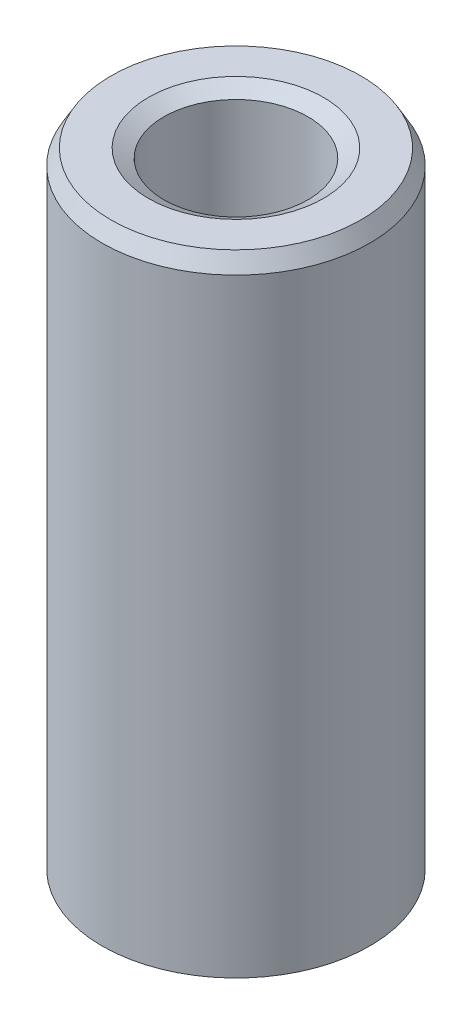
from build123d import *
from OCP.BRepFilletAPI import BRepFilletAPI_MakeChamfer

# Parameters (mm, degrees)
SKETCH1_R           = 30
BOSS_EXTRUDE1_DEPTH = 141.916776166
SKETCH2_R           = 16.142654892
CUT_EXTRUDE1_DEPTH  = 149.122825241
CHAMFER1_SIZE       = 3.484064007
CHAMFER1_SIZE2      = 2.011525292


with BuildPart() as part:
    # Sketch1 → Boss-Extrude1 (new body)
    with BuildSketch(Plane(origin=(0, 0, 0), x_dir=(1, 0, 0), z_dir=(0, 1, 0))):
        Circle(SKETCH1_R)
    extrude(amount=BOSS_EXTRUDE1_DEPTH)

    # Sketch2 → Cut-Extrude1 (cut, through all)
    with BuildSketch(Plane(origin=(0, 0, 0), x_dir=(1, 0, 0), z_dir=(0, 1, 0))):
        Circle(SKETCH2_R)
    extrude(amount=CUT_EXTRUDE1_DEPTH, mode=Mode.SUBTRACT)

    # Chamfer1: one chamfer whose edges measure the first distance from different faces: ONE call of the kernel's chamfer builder (chamfer() names one face for all edges)
    chamfer1_edges_1 = [part.edges().sort_by_distance(p)[0] for p in [
        (-16.142654892, 141.916776166, 0),
    ]]
    chamfer1_side_1 = [part.faces().sort_by_distance(p)[0] for p in [
        (-29.151471863, 141.916776166, 0),
    ]]
    chamfer1_edges_2 = [part.edges().sort_by_distance(p)[0] for p in [
        (-16.142654892, 0, 0),
    ]]
    chamfer1_side_2 = [part.faces().sort_by_distance(p)[0] for p in [
        (-16.142654892, 70.958388083, 0),
    ]]
    chamfer1_edges_3 = [part.edges().sort_by_distance(p)[0] for p in [
        (-30, 0, 0),
    ]]
    chamfer1_side_3 = [part.faces().sort_by_distance(p)[0] for p in [
        (-29.151471863, 0, 0),
    ]]
    chamfer1_edges_4 = [part.edges().sort_by_distance(p)[0] for p in [
        (-30, 141.916776166, 0),
    ]]
    chamfer1_side_4 = [part.faces().sort_by_distance(p)[0] for p in [
        (-30, 70.958388083, 0),
    ]]
    chamfer1 = BRepFilletAPI_MakeChamfer(part.part.solid().wrapped)
    for e in chamfer1_edges_1:
        chamfer1.Add(CHAMFER1_SIZE, CHAMFER1_SIZE2, e.wrapped, chamfer1_side_1[0].wrapped)  # the first distance lies on this face
    for e in chamfer1_edges_2:
        chamfer1.Add(CHAMFER1_SIZE, CHAMFER1_SIZE2, e.wrapped, chamfer1_side_2[0].wrapped)  # the first distance lies on this face
    for e in chamfer1_edges_3:
        chamfer1.Add(CHAMFER1_SIZE, CHAMFER1_SIZE2, e.wrapped, chamfer1_side_3[0].wrapped)  # the first distance lies on this face
    for e in chamfer1_edges_4:
        chamfer1.Add(CHAMFER1_SIZE, CHAMFER1_SIZE2, e.wrapped, chamfer1_side_4[0].wrapped)  # the first distance lies on this face
    add(Compound.cast(chamfer1.Shape()), mode=Mode.REPLACE)


solid = part.part
